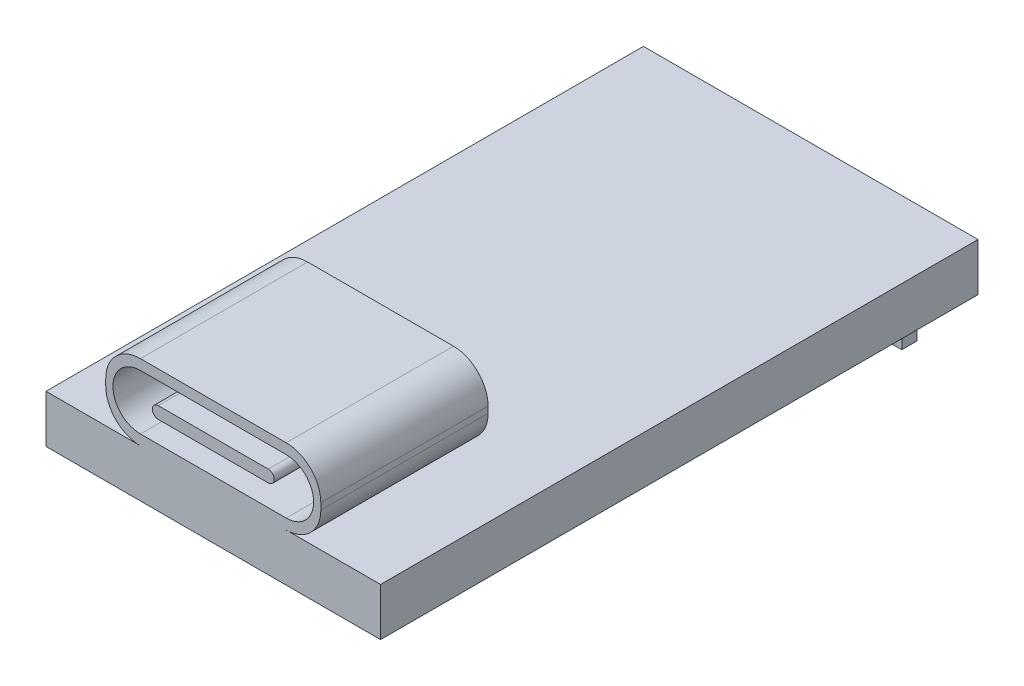
from build123d import *

# Parameters (mm, degrees)
SKETCH1_W           = 14
SKETCH1_H           = 25
BOSS_EXTRUDE1_DEPTH = 2
SKETCH2_W           = 9
SKETCH2_H           = 7
BOSS_EXTRUDE2_DEPTH = 3.16
CUT_EXTRUDE1_DEPTH  = 7.16
CUT_EXTRUDE2_DEPTH  = 2.16
CUT_EXTRUDE3_DEPTH  = 2.16
SKETCH7_W           = 0.64
SKETCH7_H           = 0.64
BOSS_EXTRUDE3_DEPTH = 2


with BuildPart() as part:
    # Sketch1 → Boss-Extrude1 (new body)
    with BuildSketch(Plane(origin=(0, 0, 0), x_dir=(1, 0, 0), z_dir=(0, 1, 0))):
        with Locations((7, 12.5)):
            Rectangle(SKETCH1_W, SKETCH1_H)
    extrude(amount=BOSS_EXTRUDE1_DEPTH)

    # Sketch2 → Boss-Extrude2 (add)
    with BuildSketch(Plane(origin=(0, 2, 0), x_dir=(1, 0, 0), z_dir=(0, 1, 0))):
        with Locations((7, 3.5)):
            Rectangle(SKETCH2_W, SKETCH2_H)
    extrude(amount=BOSS_EXTRUDE2_DEPTH)

    # Sketch3 → Cut-Extrude1 (cut)
    with BuildSketch(Plane.XY):
        with BuildLine():
            ThreePointArc((11.5, 3.45), (11.075304833, 2.424695167), (10.05, 2))
            Line((10.05, 2), (11.5, 2))
            Line((11.5, 2), (11.5, 3.45))
        make_face()
        with BuildLine():
            Line((2.5, 2), (3.95, 2))
            ThreePointArc((3.95, 2), (2.924695167, 2.424695167), (2.5, 3.45))
            Line((2.5, 3.45), (2.5, 2))
        make_face()
        with BuildLine():
            ThreePointArc((10.05, 5.16), (11.075304833, 4.735304833), (11.5, 3.71))
            Line((11.5, 3.71), (11.5, 5.16))
            Line((11.5, 5.16), (10.05, 5.16))
        make_face()
        with BuildLine():
            Line((2.5, 5.16), (2.5, 3.71))
            ThreePointArc((2.5, 3.71), (2.924695167, 4.735304833), (3.95, 5.16))
            Line((3.95, 5.16), (2.5, 5.16))
        make_face()
    extrude(amount=-CUT_EXTRUDE1_DEPTH, mode=Mode.SUBTRACT)

    # Sketch4 → Cut-Extrude2 (cut)
    with BuildSketch(Plane.XY):
        with BuildLine():
            Line((3.95, 4.73), (10.05, 4.73))
            ThreePointArc((10.05, 4.73), (11.2, 3.58), (10.05, 2.43))
            Line((10.05, 2.43), (3.95, 2.43))
            ThreePointArc((3.95, 2.43), (2.8, 3.58), (3.95, 4.73))
        make_face()
        with BuildLine():
            Line((3.95, 3.83), (10.05, 3.83))
            ThreePointArc((10.05, 3.83), (10.3, 3.58), (10.05, 3.33))
            Line((10.05, 3.33), (3.95, 3.33))
            ThreePointArc((3.95, 3.33), (3.7, 3.58), (3.95, 3.83))
        make_face(mode=Mode.SUBTRACT)
    extrude(amount=-CUT_EXTRUDE2_DEPTH, mode=Mode.SUBTRACT)

    # Sketch5 → Cut-Extrude3 (cut)
    with BuildSketch(Plane.XY):
        with BuildLine():
            ThreePointArc((4.7, 3.33), (4.45, 3.58), (4.7, 3.83))
            Line((4.7, 3.83), (3.95, 3.83))
            ThreePointArc((3.95, 3.83), (3.7, 3.58), (3.95, 3.33))
            Line((3.95, 3.33), (4.7, 3.33))
        make_face()
        with BuildLine():
            Line((10.05, 3.83), (9.3, 3.83))
            ThreePointArc((9.3, 3.83), (9.55, 3.58), (9.3, 3.33))
            Line((9.3, 3.33), (10.05, 3.33))
            ThreePointArc((10.05, 3.33), (10.3, 3.58), (10.05, 3.83))
        make_face()
    extrude(amount=-CUT_EXTRUDE3_DEPTH, mode=Mode.SUBTRACT)

    # Sketch7 → Boss-Extrude3 (add)
    with BuildSketch(Plane.XZ):
        with Locations((1.92, -23.73)):
            Rectangle(SKETCH7_W, SKETCH7_H)
        with Locations((4.46, -23.73)):
            Rectangle(SKETCH7_W, SKETCH7_H)
        with Locations((7, -23.73)):
            Rectangle(SKETCH7_W, SKETCH7_H)
        with Locations((9.54, -23.73)):
            Rectangle(SKETCH7_W, SKETCH7_H)
        with Locations((12.08, -23.73)):
            Rectangle(SKETCH7_W, SKETCH7_H)
    extrude(amount=BOSS_EXTRUDE3_DEPTH)


solid = part.part
